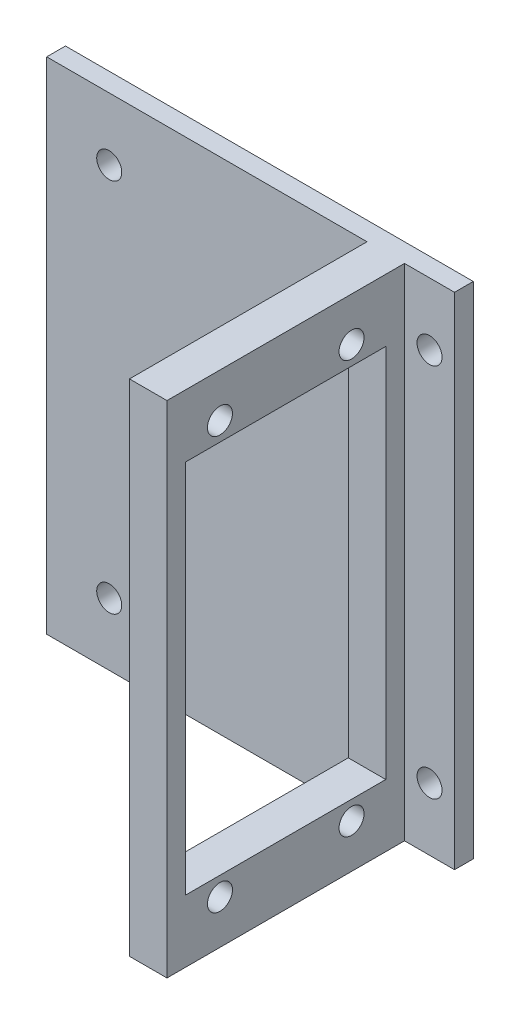
from build123d import *

# Parameters (mm, degrees)
CROQUIS2_W                 = 34.5
CROQUIS2_H                 = 80
SALIENTE_EXTRUIR2_DEPTH    = 3
CROQUIS3_W                 = 6
CROQUIS3_H                 = 80
SALIENTE_EXTRUIR3_DEPTH    = 38
CORTAR_EXTRUIR3_DEPTH      = 64.112993908
CORTAR_EXTRUIR3_DEPTH_BACK = 64.112993908
CROQUIS7_W                 = 32
CROQUIS7_H                 = 60
CROQUIS5_R                 = 2
CORTAR_EXTRUIR2_DEPTH      = 61.837899372
CROQUIS8_W                 = 3
CROQUIS8_H                 = 80
SALIENTE_EXTRUIR5_DEPTH    = 30.74
CROQUIS9_R                 = 2
CORTAR_EXTRUIR4_DEPTH      = 30.74
CROQUIS10_R                = 2
CORTAR_EXTRUIR5_DEPTH      = 194


with BuildPart() as part:
    # Croquis2 → Saliente-Extruir2 (new body)
    with BuildSketch(Plane.XY):
        Rectangle(CROQUIS2_W, CROQUIS2_H)
    extrude(amount=SALIENTE_EXTRUIR2_DEPTH)

    # Croquis3 → Saliente-Extruir3 (add)
    with BuildSketch(Plane.XY.offset(3)):
        with Locations((6.25, 0)):
            Rectangle(CROQUIS3_W, CROQUIS3_H)
    extrude(amount=SALIENTE_EXTRUIR3_DEPTH)

    # Croquis7 → Cortar-Extruir3 (cut, two sides: drawn at the far end of the back side and taken through both)
    with BuildSketch(Plane(origin=(9.25, 0, 0), x_dir=(0, 0, -1), z_dir=(1, 0, 0)).offset(-CORTAR_EXTRUIR3_DEPTH_BACK)):
        with Locations((-22, 0)):
            Rectangle(CROQUIS7_W, CROQUIS7_H)
    extrude(amount=CORTAR_EXTRUIR3_DEPTH + CORTAR_EXTRUIR3_DEPTH_BACK, mode=Mode.SUBTRACT)

    # Croquis5 → Cortar-Extruir2 (cut, through all)
    with BuildSketch(Plane.ZY.offset(-3.25)):
        with Locations((11.475, 33)):
            Circle(CROQUIS5_R)
        with Locations((32.525, 33)):
            Circle(CROQUIS5_R)
        with Locations((32.525, -33)):
            Circle(CROQUIS5_R)
        with Locations((11.475, -33)):
            Circle(CROQUIS5_R)
    extrude(amount=-CORTAR_EXTRUIR2_DEPTH, mode=Mode.SUBTRACT)

    # Croquis8 → Saliente-Extruir5 (add)
    with BuildSketch(Plane(origin=(-17.25, -40, 0), x_dir=(0, 0, -1), z_dir=(1, 0, 0))):
        with Locations((-1.5, 40)):
            Rectangle(CROQUIS8_W, CROQUIS8_H)
    extrude(amount=-SALIENTE_EXTRUIR5_DEPTH)

    # Croquis9 → Cortar-Extruir4 (cut)
    with BuildSketch(Plane.XY.offset(3)):
        with Locations((-37.99, 30)):
            Circle(CROQUIS9_R)
        with Locations((-37.99, -30)):
            Circle(CROQUIS9_R)
    extrude(amount=-CORTAR_EXTRUIR4_DEPTH, mode=Mode.SUBTRACT)

    # Croquis10 → Cortar-Extruir5 (cut)
    with BuildSketch(Plane.XY.offset(3)):
        with Locations((13.25, 30)):
            Circle(CROQUIS10_R)
        with Locations((13.25, -30)):
            Circle(CROQUIS10_R)
    extrude(amount=-CORTAR_EXTRUIR5_DEPTH, mode=Mode.SUBTRACT)


solid = part.part
